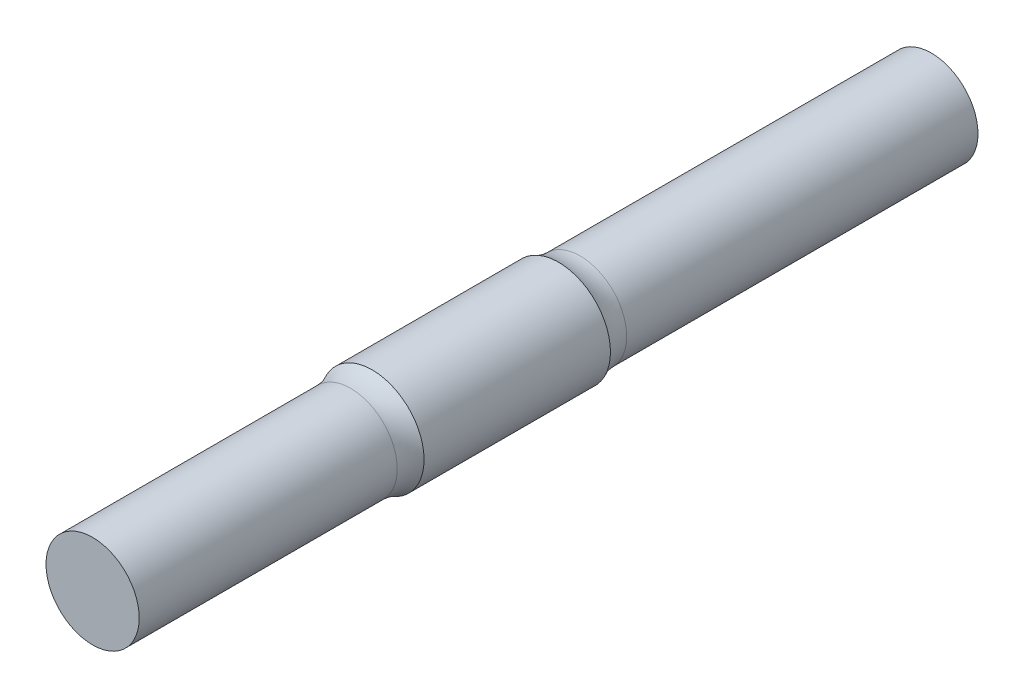
from build123d import *

# Parameters (mm, degrees)
SKETCH1_R           = 5.565
BOSS_EXTRUDE1_DEPTH = 10
SKETCH2_R           = 5
BOSS_EXTRUDE2_DEPTH = 30
BOSS_EXTRUDE3_START = 40
SKETCH3_R           = 5
BOSS_EXTRUDE3_DEPTH = 40
FILLET2_R           = 5


with BuildPart() as part:
    # Sketch1 → Boss-Extrude1 (new, symmetric)
    with BuildSketch(Plane.XY):
        Circle(SKETCH1_R)
    extrude(amount=BOSS_EXTRUDE1_DEPTH, both=True)

    # Sketch2 → Boss-Extrude2 (add)
    with BuildSketch(Plane.XY.offset(10)):
        Circle(SKETCH2_R)
    extrude(amount=BOSS_EXTRUDE2_DEPTH)

    # Sketch3 → Boss-Extrude3 (add)
    with BuildSketch(Plane(origin=(0, 0, -10), x_dir=(-1, 0, 0), z_dir=(0, 0, -1)).offset(BOSS_EXTRUDE3_START)):
        with Locations(Location((0, 0, 0), (0, 0, 180))):
            Circle(SKETCH3_R)
    extrude(amount=-BOSS_EXTRUDE3_DEPTH)

    # Fillet2
    # the kernel refuses this fillet: 5 mm, written as the material it adds along each edge
    with BuildSketch(Plane(origin=(0, 0, 10), x_dir=(1, 0, 0), z_dir=(0, -1, 0))) as fillet2_piece_1:
        with BuildLine():
            CenterArc((10, 2.308847115), FILLET2_R, 180, 27.501344198)
            Line((5, 2.308847115), (4.9, 2.308847115))
            Line((4.9, 2.308847115), (4.9, 0))
            Line((4.9, 0), (5, -0.1))
            ThreePointArc((5, -0.1), (5.2825, -0.1), (5.4763, -0.046176942))
            Line((5.4763, -0.046176942), (5.565, 0))
        make_face()
    revolve(axis=Axis((0, 0, 10), (0, 0, 1)))
    with BuildSketch(Plane(origin=(0, 0, -10), x_dir=(1, 0, 0), z_dir=(0, 1, 0))) as fillet2_piece_2:
        with BuildLine():
            CenterArc((10, 2.308847115), FILLET2_R, 180, 27.501344198)
            Line((5, 2.308847115), (4.9, 2.308847115))
            Line((4.9, 2.308847115), (4.9, 0))
            Line((4.9, 0), (5, -0.1))
            ThreePointArc((5, -0.1), (5.2825, -0.1), (5.4763, -0.046176942))
            Line((5.4763, -0.046176942), (5.565, 0))
        make_face()
    revolve(axis=Axis((0, 0, -10), (0, 0, -1)))


solid = part.part
